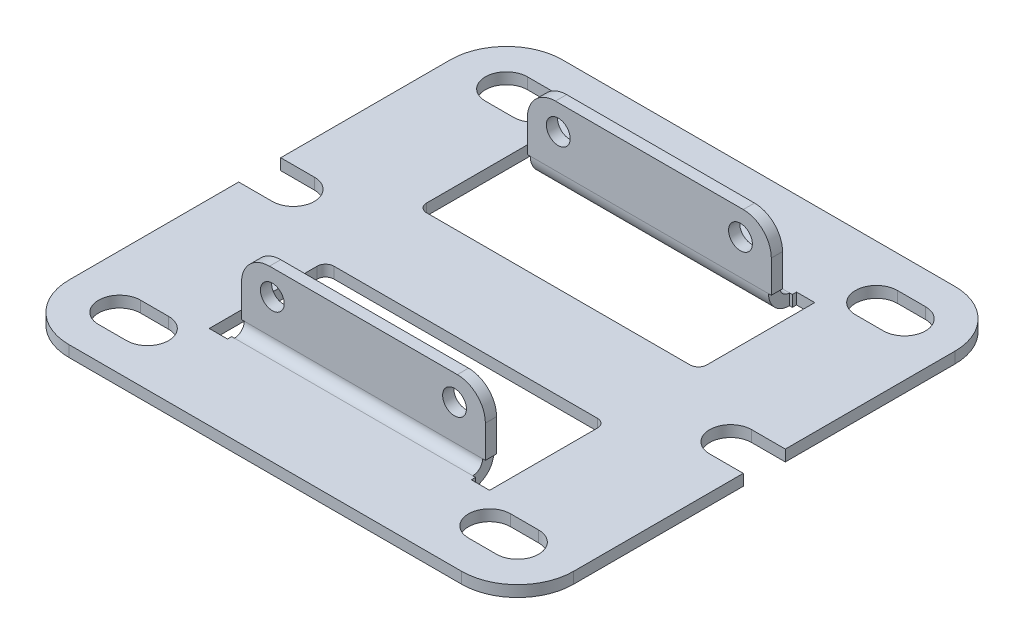
from build123d import *

# Parameters (mm, degrees)
IZIM1_W                 = 180
IZIM1_H                 = 176
TABAN_FLAN_1_DEPTH      = 4
RADYUS1_R               = 20
KES_EKSTR_ZYON1_DEPTH   = 10
IZIM7_W                 = 100
IZIM7_H                 = 116
KES_EKSTR_ZYON2_DEPTH   = 10
KENAR_FLAN_1_DEPTH      = 86.996406433
KENAR_FLAN_1_BEND_DEPTH = 87
IZIM14_R                = 4.25
KES_EKSTR_ZYON3_DEPTH   = 146
RADYUS2_R               = 10
IZIM15_W                = 125
IZIM15_H                = 33
SEKME1_DEPTH            = 4
RADYUS3_R               = 3
KES_EKSTR_ZYON4_DEPTH   = 1
KES_EKSTR_ZYON5_DEPTH   = 1
KES_EKSTR_ZYON6_DEPTH   = 10


# Sheet-metal steps are written as plain solids
with BuildPart() as part:
    # Çizim1 → Taban-Flanş1 (new body)
    with BuildSketch(Plane(origin=(0, 0, 0), x_dir=(1, 0, 0), z_dir=(0, 1, 0))):
        Rectangle(IZIM1_W, IZIM1_H)
    extrude(amount=-TABAN_FLAN_1_DEPTH)

    # Radyus1
    radyus1_edges = [part.edges().sort_by_distance(p)[0] for p in [
        (-90, -2, -88),
        (90, -2, -88),
        (90, -2, 88),
        (-90, -2, 88),
    ]]
    fillet(radyus1_edges, radius=RADYUS1_R)

    # Çizim6 → Kes-Ekstrüzyon1 (cut)
    with BuildSketch(Plane(origin=(0, 0, 0), x_dir=(1, 0, 0), z_dir=(0, 1, 0))):
        with BuildLine():
            Line((-71, -61.5), (-61, -61.5))
            ThreePointArc((-61, -61.5), (-53.5, -69), (-61, -76.5))
            Line((-61, -76.5), (-71, -76.5))
            ThreePointArc((-71, -76.5), (-78.5, -69), (-71, -61.5))
        make_face()
        with BuildLine():
            Line((-71, 76.5), (-61, 76.5))
            ThreePointArc((-61, 76.5), (-53.5, 69), (-61, 61.5))
            Line((-61, 61.5), (-71, 61.5))
            ThreePointArc((-71, 61.5), (-78.5, 69), (-71, 76.5))
        make_face()
        with BuildLine():
            Line((71, 61.5), (61, 61.5))
            ThreePointArc((61, 61.5), (53.5, 69), (61, 76.5))
            Line((61, 76.5), (71, 76.5))
            ThreePointArc((71, 76.5), (78.5, 69), (71, 61.5))
        make_face()
        with BuildLine():
            Line((71, -76.5), (61, -76.5))
            ThreePointArc((61, -76.5), (53.5, -69), (61, -61.5))
            Line((61, -61.5), (71, -61.5))
            ThreePointArc((71, -61.5), (78.5, -69), (71, -76.5))
        make_face()
    extrude(amount=-KES_EKSTR_ZYON1_DEPTH, mode=Mode.SUBTRACT)

    # Çizim7 → Kes-Ekstrüzyon2 (cut)
    with BuildSketch(Plane(origin=(0, 0, 0), x_dir=(1, 0, 0), z_dir=(0, 1, 0))):
        Rectangle(IZIM7_W, IZIM7_H)
    extrude(amount=-KES_EKSTR_ZYON2_DEPTH, mode=Mode.SUBTRACT)

    # Kenar-Flanş1 section (across the edge) → Kenar-Flanş1 (add)
    with BuildSketch(Plane(origin=(43.5, 0, 53), x_dir=(0, 0, 1), z_dir=(-1, 0, 0))):
        with BuildLine():
            Line((-4, 3.5), (-4, 25))
            Line((-4, 25), (0, 25))
            Line((0, 25), (0, 3.5))
            ThreePointArc((0, 3.5), (1.025126266, 1.025126266), (3.5, 0))
            Line((3.5, 0), (5, 0))
            Line((5, 0), (5, -4))
            Line((5, -4), (3.5, -4))
            ThreePointArc((3.5, -4), (-1.803300859, -1.803300859), (-4, 3.5))
        make_face()
    extrude(amount=KENAR_FLAN_1_DEPTH)

    # Kenar-Flanş1 section 2 (across the edge) → Kenar-Flanş1 bend (add)
    with BuildSketch(Plane(origin=(-43.5, 0, -53), x_dir=(0, 0, -1), z_dir=(1, 0, 0))):
        with BuildLine():
            Line((-4, 3.5), (-4, 25))
            Line((-4, 25), (0, 25))
            Line((0, 25), (0, 3.5))
            ThreePointArc((0, 3.5), (1.025126266, 1.025126266), (3.5, 0))
            Line((3.5, 0), (5, 0))
            Line((5, 0), (5, -4))
            Line((5, -4), (3.5, -4))
            ThreePointArc((3.5, -4), (-1.803300859, -1.803300859), (-4, 3.5))
        make_face()
    extrude(amount=KENAR_FLAN_1_BEND_DEPTH)

    # Çizim14 → Kes-Ekstrüzyon3 (cut)
    with BuildSketch(Plane(origin=(0, 0, -53), x_dir=(-1, 0, 0), z_dir=(0, 0, -1))):
        with Locations((-32.5, 16)):
            Circle(IZIM14_R)
        with Locations((32.5, 16)):
            Circle(IZIM14_R)
    extrude(amount=-KES_EKSTR_ZYON3_DEPTH, mode=Mode.SUBTRACT)

    # Radyus2
    radyus2_edges = [part.edges().sort_by_distance(p)[0] for p in [
        (43.5, 25, 51),
        (-43.496406433, 25, 51),
        (-43.5, 25, -51),
        (43.5, 25, -51),
    ]]
    fillet(radyus2_edges, radius=RADYUS2_R)

    # Çizim15 → Sekme1 (add)
    with BuildSketch(Plane(origin=(0, 0, 0), x_dir=(1, 0, 0), z_dir=(0, 1, 0))):
        Rectangle(IZIM15_W, IZIM15_H)
    extrude(amount=-SEKME1_DEPTH)

    # Radyus3
    radyus3_edges = [part.edges().sort_by_distance(p)[0] for p in [
        (-50, -2, 16.5),
        (-50, -2, -16.5),
        (50, -2, -16.5),
        (50, -2, 16.5),
    ]]
    fillet(radyus3_edges, radius=RADYUS3_R)

    # Çizim18 → Kes-Ekstrüzyon4 (cut)
    with BuildSketch(Plane(origin=(43.5, 0, 0), x_dir=(0, 0, -1), z_dir=(1, 0, 0))):
        with BuildLine():
            Line((53, 3.5), (49, 3.5))
            ThreePointArc((49, 3.5), (51.196699141, -1.803300859), (56.5, -4))
            Line((56.5, -4), (56.5, 0))
            ThreePointArc((56.5, 0), (54.025126266, 1.025126266), (53, 3.5))
        make_face()
        with BuildLine():
            Line((-49, 3.5), (-53, 3.5))
            ThreePointArc((-53, 3.5), (-54.025126266, 1.025126266), (-56.5, 0))
            Line((-56.5, 0), (-56.5, -4))
            ThreePointArc((-56.5, -4), (-51.196699141, -1.803300859), (-49, 3.5))
        make_face()
    extrude(amount=-KES_EKSTR_ZYON4_DEPTH, mode=Mode.SUBTRACT)

    # Çizim19 → Kes-Ekstrüzyon5 (cut)
    with BuildSketch(Plane.ZY.offset(43.5)):
        with BuildLine():
            Line((-49, 3.5), (-53, 3.5))
            ThreePointArc((-53, 3.5), (-54.025126266, 1.025126266), (-56.5, 0))
            Line((-56.5, 0), (-56.5, -4))
            ThreePointArc((-56.5, -4), (-51.196699141, -1.803300859), (-49, 3.5))
        make_face()
        with BuildLine():
            Line((53, 3.5), (49, 3.5))
            ThreePointArc((49, 3.5), (51.196699141, -1.803300859), (56.5, -4))
            Line((56.5, -4), (56.5, 0))
            ThreePointArc((56.5, 0), (54.025126266, 1.025126266), (53, 3.5))
        make_face()
    extrude(amount=-KES_EKSTR_ZYON5_DEPTH, mode=Mode.SUBTRACT)

    # Çizim20 → Kes-Ekstrüzyon6 (cut)
    with BuildSketch(Plane(origin=(0, 0, 0), x_dir=(1, 0, 0), z_dir=(0, 1, 0))):
        with BuildLine():
            Line((102, -7.5), (78, -7.5))
            ThreePointArc((78, -7.5), (70.5, 0), (78, 7.5))
            Line((78, 7.5), (102, 7.5))
            ThreePointArc((102, 7.5), (109.5, 0), (102, -7.5))
        make_face()
        with BuildLine():
            Line((-102, 7.5), (-78, 7.5))
            ThreePointArc((-78, 7.5), (-70.5, 0), (-78, -7.5))
            Line((-78, -7.5), (-102, -7.5))
            ThreePointArc((-102, -7.5), (-109.5, 0), (-102, 7.5))
        make_face()
    extrude(amount=-KES_EKSTR_ZYON6_DEPTH, mode=Mode.SUBTRACT)


solid = part.part
